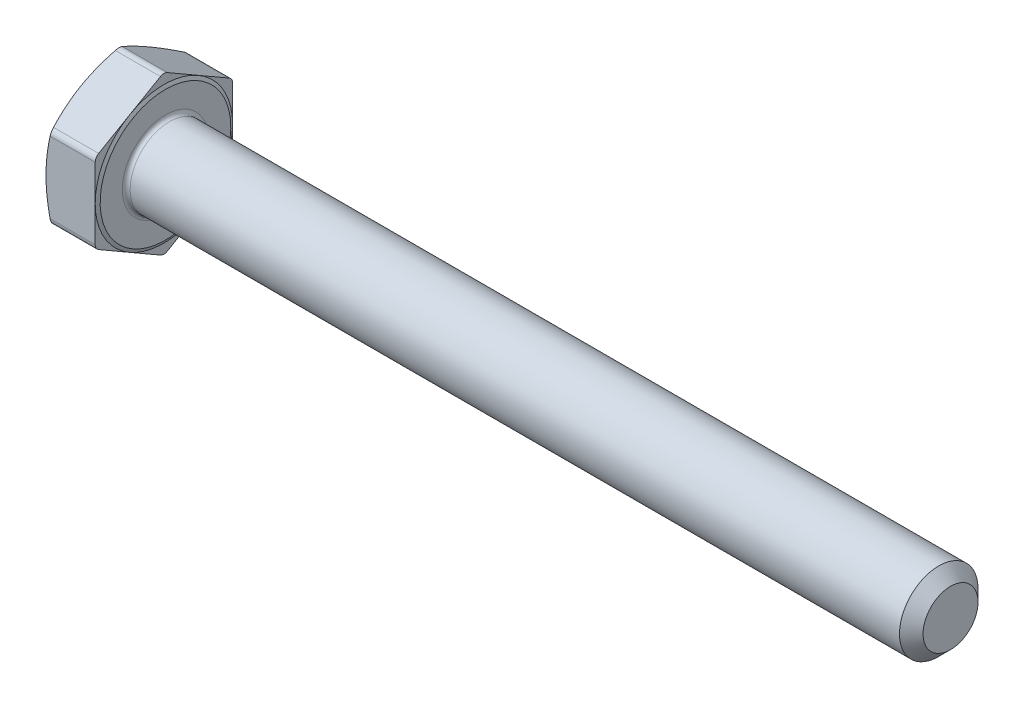
from build123d import *

# Parameters (mm, degrees)
SKETCH2_R                = 3.175
BOSS_EXTRUDE1_DEPTH      = 63.5
BOSS_EXTRUDE2_DEPTH      = 4.365625
SKETCH5_OUTSIDE_W        = 45.828
SKETCH5_OUTSIDE_H        = 47.548
SKETCH5_OUTSIDE_R        = 5.000625
CUT_EXTRUDE1_DEPTH       = 4.365625
CUT_EXTRUDE1_DRAFT       = -65
BOSS_EXTRUDE5_DEPTH      = 0.0635
FILLET5_R                = 0.0635
CIRPATTERN1_COUNT        = 6
FILLET5_OF_CIRPATTERN1_R = 0.0635
FILLET7_R                = 0.555625
CHAMFER1_SIZE            = 0.9525
FILLET4_R                = 0.3175


with BuildPart() as part:
    # Sketch2 → Boss-Extrude1 (new body)
    with BuildSketch(Plane(origin=(0, 0, 0), x_dir=(0, 0, -1), z_dir=(1, 0, 0))):
        Circle(SKETCH2_R)
    extrude(amount=BOSS_EXTRUDE1_DEPTH)

    # Sketch3 → Boss-Extrude2 (add)
    with BuildSketch(Plane.ZY):
        Polygon((0, 6.415804866), (-5.55625, 3.207902433), (-5.55625, -3.207902433), (0, -6.415804866), (5.55625, -3.207902433), (5.55625, 3.207902433), align=None)
    extrude(amount=BOSS_EXTRUDE2_DEPTH)


with BuildPart() as cut_extrude1_tool:
    # Sketch5 outside → Cut-Extrude1 (with draft: the straight prism first)
    with BuildSketch(Plane.ZY.offset(4.365625)):
        Rectangle(SKETCH5_OUTSIDE_W, SKETCH5_OUTSIDE_H)
        Circle(SKETCH5_OUTSIDE_R, mode=Mode.SUBTRACT)
    extrude(amount=-CUT_EXTRUDE1_DEPTH)
    # Cut-Extrude1: the draft: its side faces are tilted about the plane it starts from
    cut_extrude1_sides = [cut_extrude1_tool.faces().sort_by_distance(p)[0] for p in [
        (-2.1828125, -23.774, 0),
        (-2.1828125, 0, 22.914),
        (-2.1828125, 23.774, 0),
        (-2.1828125, 0, -22.914),
        (-2.1828125, 0, -5.000625),
    ]]
    draft(cut_extrude1_sides, Plane.ZY.offset(4.365625), CUT_EXTRUDE1_DRAFT)


with BuildPart() as part_1:
    add(part.part)

    # Cut-Extrude1: cut by cut_extrude1_tool
    add(cut_extrude1_tool.part, mode=Mode.SUBTRACT)

    # Sketch11 → Boss-Extrude5 (add)
    with BuildSketch(Plane.ZY.offset(4.365625)):
        with BuildLine():
            Line((0.22225, 3.9449375), (0.22225, 2.44475))
            ThreePointArc((0.22225, 2.44475), (0, 2.2225), (-0.22225, 2.44475))
            Line((-0.22225, 2.44475), (-0.22225, 3.9449375))
            ThreePointArc((-0.22225, 3.9449375), (0, 4.1671875), (0.22225, 3.9449375))
        make_face()
    boss_extrude5 = extrude(amount=BOSS_EXTRUDE5_DEPTH)

    # Fillet5
    fillet5_edges = [part_1.edges().sort_by_distance(p)[0] for p in [
        (-4.429125, 3.19484375, 0.22225),
        (-4.429125, 2.2225, 0),
        (-4.429125, 3.19484375, -0.22225),
        (-4.429125, 4.1671875, 0),
    ]]
    fillet(fillet5_edges, radius=FILLET5_R - 0.0001)  # a hair under: the kernel refuses the full size

    # CirPattern1: Boss-Extrude5 ×6 about axis
    cirpattern1_axis = Axis((0, 0, 0), (1, 0, 0))
    for i in range(1, CIRPATTERN1_COUNT):
        add(boss_extrude5.rotate(cirpattern1_axis, i * 360 / CIRPATTERN1_COUNT))

    # Fillet5 of CirPattern1
    fillet5_of_cirpattern1_edges = [part_1.edges().sort_by_distance(p)[0] for p in [
        (-4.429125, 1.404947729, 2.877940849),
        (-4.429125, 1.11125, 1.92474146),
        (-4.429125, 1.789896021, 2.655690849),
        (-4.429125, 2.08359375, 3.608890237),
        (-4.429125, -1.789896021, 2.655690849),
        (-4.429125, -1.11125, 1.92474146),
        (-4.429125, -1.404947729, 2.877940849),
        (-4.429125, -2.08359375, 3.608890237),
        (-4.429125, -3.19484375, -0.22225),
        (-4.429125, -2.2225, 0),
        (-4.429125, -3.19484375, 0.22225),
        (-4.429125, -4.1671875, 0),
        (-4.429125, -1.404947729, -2.877940849),
        (-4.429125, -1.11125, -1.92474146),
        (-4.429125, -1.789896021, -2.655690849),
        (-4.429125, -2.08359375, -3.608890237),
        (-4.429125, 1.789896021, -2.655690849),
        (-4.429125, 1.11125, -1.92474146),
        (-4.429125, 1.404947729, -2.877940849),
        (-4.429125, 2.08359375, -3.608890237),
    ]]
    fillet(fillet5_of_cirpattern1_edges, radius=FILLET5_OF_CIRPATTERN1_R - 0.0001)  # a hair under: the kernel refuses the full size

    # Fillet7
    fillet7_edges = [part_1.edges().sort_by_distance(p)[0] for p in [
        (-1.852857895, -6.415804866, 0),
        (-1.852857895, -3.207902433, -5.55625),
        (-1.852857895, 3.207902433, -5.55625),
        (-1.852857895, 6.415804866, 0),
        (-1.852857895, -3.207902433, 5.55625),
        (-1.852857895, 3.207902433, 5.55625),
    ]]
    fillet(fillet7_edges, radius=FILLET7_R)

    # Chamfer1
    chamfer1_edges = [part_1.edges().sort_by_distance(p)[0] for p in [
        (63.5, 0, 3.175),
    ]]
    chamfer(chamfer1_edges, length=CHAMFER1_SIZE)

    # Sketch15 → Cut-Revolve1 (revolve, cut)
    with BuildSketch(Plane.XY, mode=Mode.PRIVATE) as cut_revolve1_sk:
        Polygon((0, 5.283897621), (-0.127, 5.55625), (-0.127, 6.415804866), (0, 6.415804866), align=None)
    revolve(cut_revolve1_sk.sketch.rotate(Axis((0, 0, 0), (-1, 0, 0)), 210), axis=Axis((0, 0, 0), (-1, 0, 0)), mode=Mode.SUBTRACT)

    # Fillet4
    fillet4_edges = [part_1.edges().sort_by_distance(p)[0] for p in [
        (0, 0, 3.175),
    ]]
    fillet(fillet4_edges, radius=FILLET4_R)


solid = part_1.part
